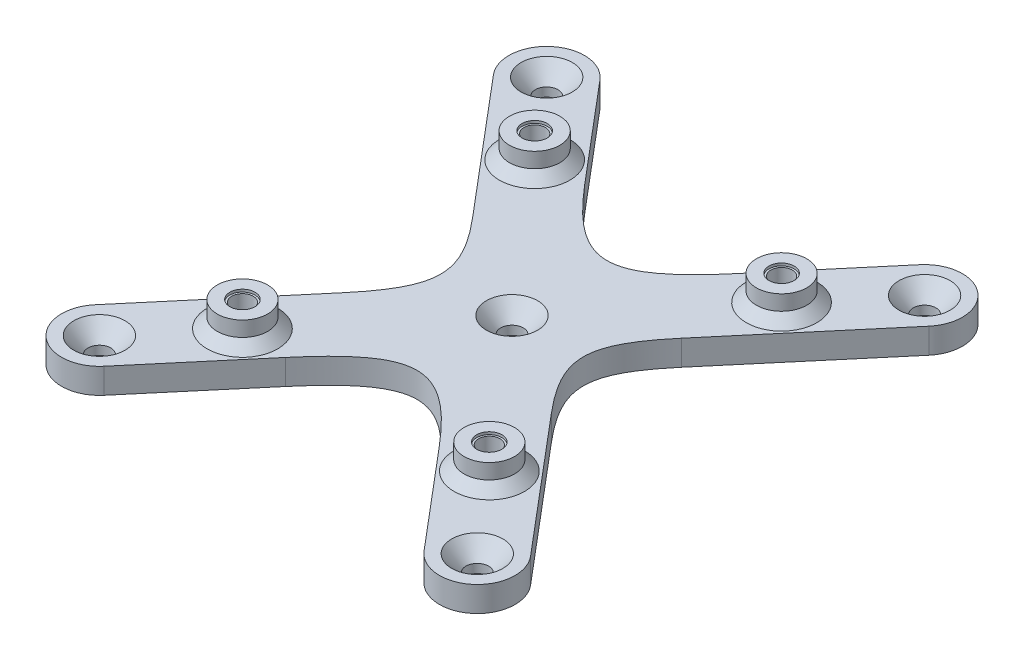
from build123d import *

# Parameters (mm, degrees)
BOSS_EXTRUDE1_DEPTH                              = 5
CSK_FOR_8_FLAT_HEAD_SOCKET_CAP_SCREW1_A_COUNT    = 2
CSK_FOR_8_FLAT_HEAD_SOCKET_CAP_SCREW1_A_PITCH    = 75
CSK_FOR_8_FLAT_HEAD_SOCKET_CAP_SCRE_2_COUNT      = 2
CSK_FOR_8_FLAT_HEAD_SOCKET_CAP_SCRE_2_PITCH      = 116.215709833
CSK_FOR_8_FLAT_HEAD_SOCKET_CAP_SCRE_3_COUNT      = 2
CSK_FOR_8_FLAT_HEAD_SOCKET_CAP_SCRE_3_PITCH      = 88.775510204
CSK_FOR_8_FLAT_HEAD_SOCKET_CAP_SCRE_4_COUNT      = 2
CSK_FOR_8_FLAT_HEAD_SOCKET_CAP_SCRE_4_PITCH      = 58.107854917
SKETCH4_R                                        = 5
BOSS_EXTRUDE2_DEPTH                              = 5
CHAMFER1_SIZE                                    = 2
CBORE_FOR_M5_HEX_HEAD_MACHINE_SCREW1_D           = 4.25
CBORE_FOR_M5_HEX_HEAD_MACHINE_SCREW1_CBORE_D     = 5
CBORE_FOR_M5_HEX_HEAD_MACHINE_SCREW1_CBORE_DEPTH = 0.5


with BuildPart() as part:
    # Sketch1 → Boss-Extrude1 (new body)
    with BuildSketch(Plane(origin=(0, 0, 0), x_dir=(1, 0, 0), z_dir=(0, 1, 0))):
        with BuildLine():
            Line((0, -11.621570983), (-9.818223762, 0))
            Line((-9.818223762, 0), (-43.229142192, -39.547617733))
            ThreePointArc((-43.229142192, -39.547617733), (-42.340137369, -50.116897294), (-31.770857808, -49.227892471))
            Line((-31.770857808, -49.227892471), (0, -11.621570983))
        make_face()
        Polygon((9.818223762, 0), (0, 11.621570983), (-9.818223762, 0), (0, -11.621570983), align=None)
        with BuildLine():
            Line((0, 11.621570983), (-31.770857808, 49.227892471))
            ThreePointArc((-31.770857808, 49.227892471), (-42.340137369, 50.116897294), (-43.229142192, 39.547617733))
            Line((-43.229142192, 39.547617733), (-9.818223762, 0))
            Line((-9.818223762, 0), (0, 11.621570983))
        make_face()
        with BuildLine():
            Line((31.770857808, 49.227892471), (0, 11.621570983))
            Line((0, 11.621570983), (9.818223762, 0))
            Line((9.818223762, 0), (43.229142192, 39.547617733))
            ThreePointArc((43.229142192, 39.547617733), (42.340137369, 50.116897294), (31.770857808, 49.227892471))
        make_face()
        with BuildLine():
            Line((43.229142192, -39.547617733), (9.818223762, 0))
            Line((9.818223762, 0), (0, -11.621570983))
            Line((0, -11.621570983), (31.770857808, -49.227892471))
            ThreePointArc((31.770857808, -49.227892471), (42.340137369, -50.116897294), (43.229142192, -39.547617733))
        make_face()
    extrude(amount=BOSS_EXTRUDE1_DEPTH)

    # Sketch3 → CSK for #8 Flat Head Socket Cap Screw1 (revolve, cut)
    with BuildSketch(Plane(origin=(-37.5, 5, -44.387755102), x_dir=(0, 0, 1), z_dir=(1, 0, 0))):
        Polygon((0, 0), (0, 5), (2.2479, 5), (2.2479, 3.257958366), (5.08, 0), align=None)
    csk_for_8_flat_head_socket_cap_screw1 = revolve(axis=Axis((-37.5, 11.35, -44.387755102), (0, -1, 0)), mode=Mode.SUBTRACT)

    # CSK for #8 Flat Head Socket Cap Screw1 a: CSK for #8 Flat Head Socket Cap Screw1 ×2
    with Locations(*[(i * CSK_FOR_8_FLAT_HEAD_SOCKET_CAP_SCREW1_A_PITCH, 0, 0) for i in range(1, CSK_FOR_8_FLAT_HEAD_SOCKET_CAP_SCREW1_A_COUNT)]):
        add(csk_for_8_flat_head_socket_cap_screw1, mode=Mode.SUBTRACT)

    # CSK for _8 Flat Head Socket Cap Scre 2: CSK for #8 Flat Head Socket Cap Screw1 ×2
    with Locations(*[Vector(0.6453516491682099, 0, 0.7638856255460446) * (i * CSK_FOR_8_FLAT_HEAD_SOCKET_CAP_SCRE_2_PITCH) for i in range(1, CSK_FOR_8_FLAT_HEAD_SOCKET_CAP_SCRE_2_COUNT)]):
        add(csk_for_8_flat_head_socket_cap_screw1, mode=Mode.SUBTRACT)

    # CSK for _8 Flat Head Socket Cap Scre 3: CSK for #8 Flat Head Socket Cap Screw1 ×2
    with Locations(*[(0, 0, i * CSK_FOR_8_FLAT_HEAD_SOCKET_CAP_SCRE_3_PITCH) for i in range(1, CSK_FOR_8_FLAT_HEAD_SOCKET_CAP_SCRE_3_COUNT)]):
        add(csk_for_8_flat_head_socket_cap_screw1, mode=Mode.SUBTRACT)

    # CSK for _8 Flat Head Socket Cap Scre 4: CSK for #8 Flat Head Socket Cap Screw1 ×2
    with Locations(*[Vector(0.64535164916821, 0, 0.7638856255460446) * (i * CSK_FOR_8_FLAT_HEAD_SOCKET_CAP_SCRE_4_PITCH) for i in range(1, CSK_FOR_8_FLAT_HEAD_SOCKET_CAP_SCRE_4_COUNT)]):
        add(csk_for_8_flat_head_socket_cap_screw1, mode=Mode.SUBTRACT)

    # Sketch4 → Boss-Extrude2 (add)
    with BuildSketch(Plane(origin=(0, 5, 0), x_dir=(1, 0, 0), z_dir=(0, 1, 0))):
        with Locations(Location((-24.5, 29, 0), (0, 0, 270))):
            Circle(SKETCH4_R)
        with Locations(Location((24.5, 29, 0), (0, 0, 270))):
            Circle(SKETCH4_R)
        with Locations(Location((24.5, -29, 0), (0, 0, 270))):
            Circle(SKETCH4_R)
        with Locations(Location((-24.5, -29, 0), (0, 0, 270))):
            Circle(SKETCH4_R)
    extrude(amount=BOSS_EXTRUDE2_DEPTH)

    # Chamfer1
    chamfer1_edges = [part.edges().sort_by_distance(p)[0] for p in [
        (-24.5, 5, -34),
        (24.5, 5, -34),
        (24.5, 5, 24),
        (-24.5, 5, 24),
    ]]
    chamfer(chamfer1_edges, length=CHAMFER1_SIZE)

    # CBORE for M5 Hex Head Machine Screw1 (through all)
    with Locations(Plane(origin=(0, 10, 0), x_dir=(1, 0, 0), z_dir=(0, 1, 0))):
        with Locations((-24.5, 29), (24.5, 29), (24.5, -29), (-24.5, -29)):
            CounterBoreHole(CBORE_FOR_M5_HEX_HEAD_MACHINE_SCREW1_D / 2, CBORE_FOR_M5_HEX_HEAD_MACHINE_SCREW1_CBORE_D / 2, CBORE_FOR_M5_HEX_HEAD_MACHINE_SCREW1_CBORE_DEPTH)

    # Fillet1
    # a fillet whose section is not a circle: 20 mm, written as the material it adds along each edge
    with BuildSketch(Plane(origin=(-9.818223762, 0, 0), x_dir=(-0.6453516491682094, 0, 0.7638856255460448), z_dir=(0, 1, 0))) as fillet1_piece_1:
        with BuildLine():
            Bezier((16.896551724, 0), (0, 0), (-2.822442205, -16.659150043), weights=[1, 1.5, 1])
            Line((-2.822442205, -16.659150043), (0, 0))
            Line((0, 0), (16.896551724, 0))
        make_face()
    extrude(amount=5)
    with BuildSketch(Plane(origin=(9.818223762, 0, 0), x_dir=(0.6453516491682099, 0, 0.7638856255460446), z_dir=(0, 1, 0))) as fillet1_piece_2:
        with BuildLine():
            Bezier((16.896551724, 0), (0, 0), (-2.822442205, 16.659150043), weights=[1, 1.5, 1])
            Line((-2.822442205, 16.659150043), (0, 0))
            Line((0, 0), (16.896551724, 0))
        make_face()
    extrude(amount=5)
    with BuildSketch(Plane(origin=(0, 0, 11.621570983), x_dir=(-0.6453516491682095, 0, 0.7638856255460447), z_dir=(0, 1, 0))) as fillet1_piece_3:
        with BuildLine():
            Bezier((23.673469388, 0), (0, 0), (3.954475459, 23.340849957), weights=[1, 1.5, 1])
            Line((3.954475459, 23.340849957), (0, 0))
            Line((0, 0), (23.673469388, 0))
        make_face()
    extrude(amount=5)
    with BuildSketch(Plane(origin=(0, 0, -11.621570983), x_dir=(-0.6453516491682103, 0, -0.7638856255460442), z_dir=(0, 1, 0))) as fillet1_piece_4:
        with BuildLine():
            Bezier((23.673469388, 0), (0, 0), (3.954475459, -23.340849957), weights=[1, 1.5, 1])
            Line((3.954475459, -23.340849957), (0, 0))
            Line((0, 0), (23.673469388, 0))
        make_face()
    extrude(amount=5)


solid = part.part
